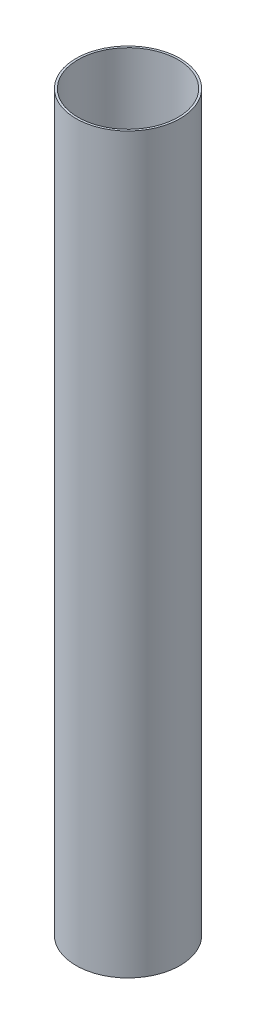
from build123d import *

# Parameters (mm, degrees)
SKETCH1_R           = 39.7
SKETCH1_R_2         = 38.1
BOSS_EXTRUDE1_DEPTH = 559


with BuildPart() as part:
    # Sketch1 → Boss-Extrude1 (new body)
    with BuildSketch(Plane(origin=(0, 0, 0), x_dir=(1, 0, 0), z_dir=(0, 1, 0))):
        Circle(SKETCH1_R)
        Circle(SKETCH1_R_2, mode=Mode.SUBTRACT)
    extrude(amount=BOSS_EXTRUDE1_DEPTH)


solid = part.part
